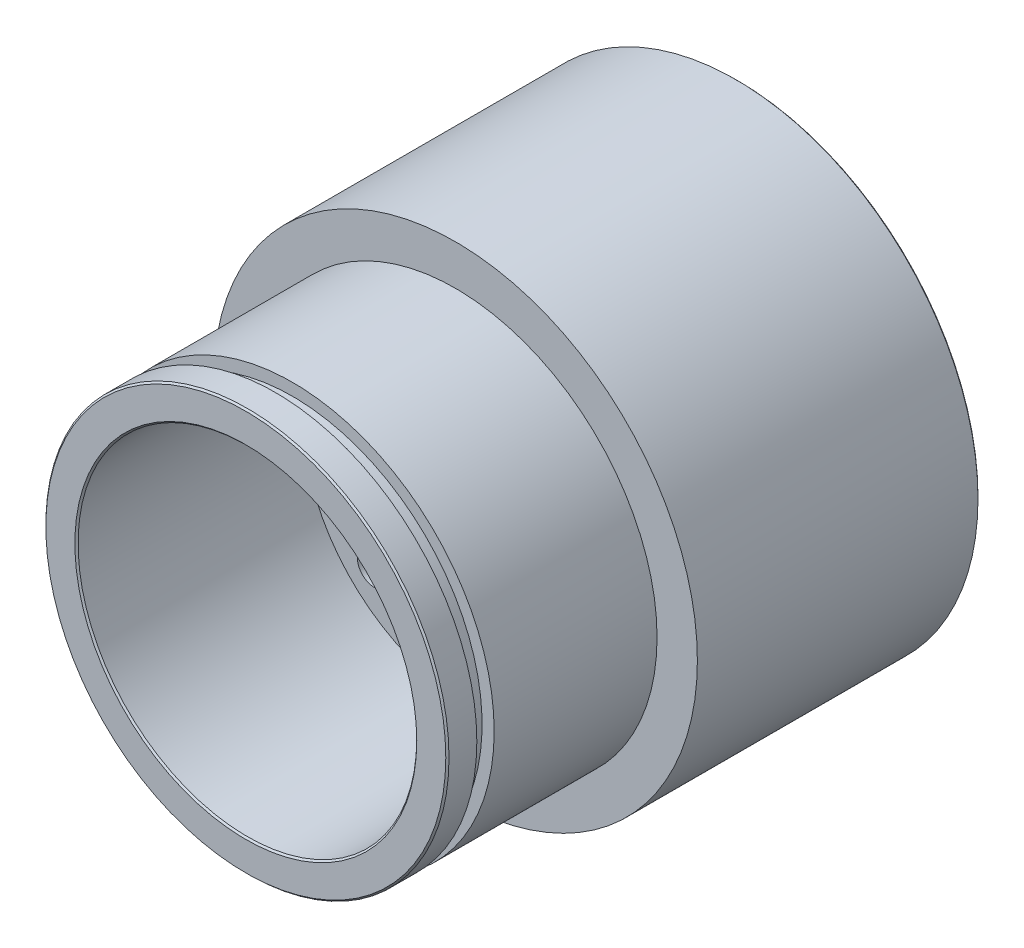
from build123d import *

# Parameters (mm, degrees)
SKETCH2_W            = 1.5
SKETCH2_H            = 2.15
CHAMFER1_SIZE        = 0.2
M4_CLEARANCE_HOLE1_D = 4.3
CIRPATTERN1_COUNT    = 4
CIRPATTERN3_COUNT    = 6


with BuildPart() as part:
    # Sketch1 → Revolve1 (revolve)
    with BuildSketch(Plane(origin=(0, 0, 0), x_dir=(1, 0, 0), z_dir=(0, 1, 0))):
        Polygon((13, 0), (21, 0), (21, -28), (25, -28), (25, -2), (30, -2), (30, 33), (20.5, 33), (20.5, 4), (13, 4), align=None)
    revolve(axis=Axis((0, 0, 0), (0, 0, -1)))

    # Sketch2 → Cut-Revolve1 (revolve, cut)
    with BuildSketch(Plane(origin=(0, 0, 0), x_dir=(1, 0, 0), z_dir=(0, 1, 0))):
        with Locations((24.25, -23.275)):
            Rectangle(SKETCH2_W, SKETCH2_H)
    revolve(axis=Axis((0, 0, 2), (0, 0, 1)), mode=Mode.SUBTRACT)

    # Chamfer1
    chamfer1_edges = [part.edges().sort_by_distance(p)[0] for p in [
        (-20.5, 0, -33),
        (-25, 0, 28),
        (-21, 0, 28),
        (-30, 0, -33),
    ]]
    chamfer(chamfer1_edges, length=CHAMFER1_SIZE)

    # M4 Clearance Hole1 (through all)
    with Locations(Plane.XY):
        with Locations((-12.02081528, 12.02081528)):
            m4_clearance_hole1 = Hole(M4_CLEARANCE_HOLE1_D / 2)

    # CirPattern1: M4 Clearance Hole1 ×4 about axis
    cirpattern1_axis = Axis((0, 0, 0), (0, 0, 1))
    for i in range(1, CIRPATTERN1_COUNT):
        add(m4_clearance_hole1.rotate(cirpattern1_axis, i * 360 / CIRPATTERN1_COUNT), mode=Mode.SUBTRACT)

    # Sketch9 → M4 Tapped Hole1 (revolve, cut)
    with BuildSketch(Plane(origin=(0, 25, -33), x_dir=(0, 1, 0), z_dir=(1, 0, 0))):
        Polygon((0, 0), (0, 12.991420021), (1.65, 12), (1.65, 0), align=None)
    m4_tapped_hole1 = revolve(axis=Axis((0, 25, -39.35), (0, 0, 1)), mode=Mode.SUBTRACT)

    # CirPattern3: M4 Tapped Hole1 ×6 about axis
    cirpattern3_axis = Axis((0, 0, 0), (0, 0, 1))
    for i in range(1, CIRPATTERN3_COUNT):
        add(m4_tapped_hole1.rotate(cirpattern3_axis, i * 360 / CIRPATTERN3_COUNT), mode=Mode.SUBTRACT)


solid = part.part
